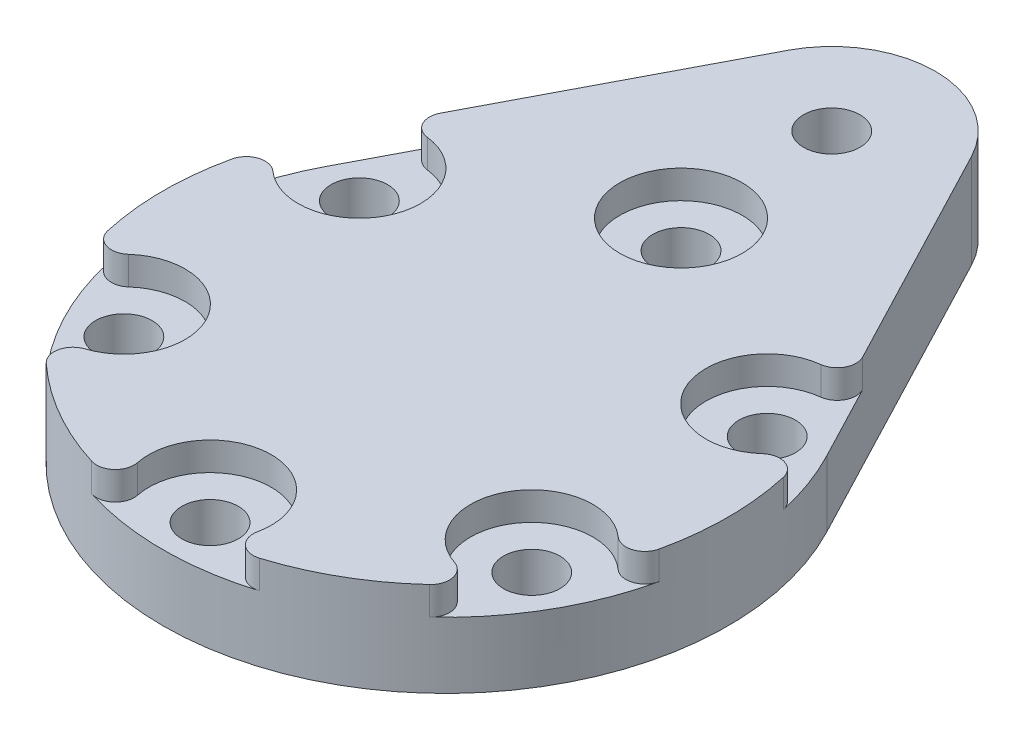
from build123d import *

# Parameters (mm, degrees)
SKETCH4_R           = 1.5
BOSS_EXTRUDE1_DEPTH = 5
SKETCH6_R           = 3.25
CUT_EXTRUDE1_DEPTH  = 1.5
FILLET1_R           = 1


with BuildPart() as part:
    # Sketch4 → Boss-Extrude1 (new body)
    with BuildSketch(Plane(origin=(0, 0, 0), x_dir=(1, 0, 0), z_dir=(0, 1, 0))):
        with BuildLine():
            Line((-4.873778619, 23.048780488), (-13.292123506, 6.951219512))
            ThreePointArc((-13.292123506, 6.951219512), (0, -15), (13.292123506, 6.951219512))
            Line((13.292123506, 6.951219512), (4.873778619, 23.048780488))
            ThreePointArc((4.873778619, 23.048780488), (0, 26), (-4.873778619, 23.048780488))
        make_face()
        with Locations((0, 20.5)):
            Circle(SKETCH4_R, mode=Mode.SUBTRACT)
        with Locations((10.825317547, 6.25)):
            Circle(SKETCH4_R, mode=Mode.SUBTRACT)
        with Locations((-10.825317547, -6.25)):
            Circle(SKETCH4_R, mode=Mode.SUBTRACT)
        with Locations((0, -12.5)):
            Circle(SKETCH4_R, mode=Mode.SUBTRACT)
        with Locations((10.825317547, -6.25)):
            Circle(SKETCH4_R, mode=Mode.SUBTRACT)
        with Locations((-10.825317547, 6.25)):
            Circle(SKETCH4_R, mode=Mode.SUBTRACT)
        with Locations((0, 12.5)):
            Circle(SKETCH4_R, mode=Mode.SUBTRACT)
    extrude(amount=BOSS_EXTRUDE1_DEPTH)

    # Sketch6 → Cut-Extrude1 (cut)
    with BuildSketch(Plane(origin=(0, 5, 0), x_dir=(1, 0, 0), z_dir=(0, 1, 0))):
        with Locations((0, 12.5)):
            Circle(SKETCH6_R)
        with Locations((10.825317547, 6.25)):
            Circle(SKETCH6_R)
        with Locations((10.825317547, -6.25)):
            Circle(SKETCH6_R)
        with Locations((0, -12.5)):
            Circle(SKETCH6_R)
        with Locations((-10.825317547, -6.25)):
            Circle(SKETCH6_R)
        with Locations((-10.825317547, 6.25)):
            Circle(SKETCH6_R)
    extrude(amount=-CUT_EXTRUDE1_DEPTH, mode=Mode.SUBTRACT)

    # Fillet1
    fillet1_edges = [part.edges().sort_by_distance(p)[0] for p in [
        (-12.094083561, 4.25, -9.242111763),
        (-13.975148162, 4.25, -5.44933334),
        (-11.706835187, 4.25, 9.37816666),
        (-13.975148162, 4.25, 5.44933334),
        (-2.268312974, 4.25, 14.8275),
        (2.268312974, 4.25, 14.8275),
        (11.706835187, 4.25, 9.37816666),
        (13.975148162, 4.25, 5.44933334),
        (13.975148162, 4.25, -5.44933334),
        (12.094083561, 4.25, -9.242111763),
    ]]
    fillet(fillet1_edges, radius=FILLET1_R)


solid = part.part
